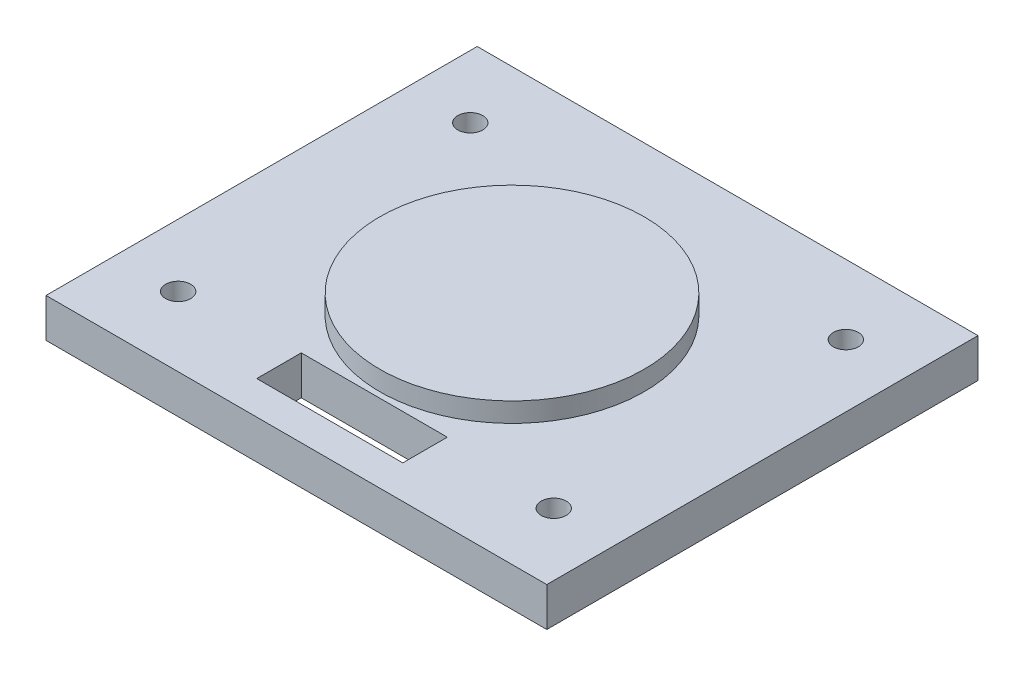
from build123d import *

# Parameters (mm, degrees)
F_01_BASE_PROFILE_W           = 360
F_01_BASE_PROFILE_H           = 310
F_01_BASE_PROFILE_R           = 62.5
F_01_BASE_PROFILE_R_2         = 9
F_01_BASE_PROFILE_W_2         = 105
F_01_BASE_PROFILE_H_2         = 32
F_01_BASE_EXTRUDE_DEPTH       = 28
F_02_BOSS_PROFILE_R           = 95
F_02_REINFORCEMENT_BOSS_DEPTH = 42


with BuildPart() as part:
    # 01_Base_Profile → 01_Base_Extrude (new body)
    with BuildSketch(Plane(origin=(0, 0, 0), x_dir=(1, 0, 0), z_dir=(0, 1, 0))):
        Rectangle(F_01_BASE_PROFILE_W, F_01_BASE_PROFILE_H)
        Circle(F_01_BASE_PROFILE_R, mode=Mode.SUBTRACT)
        with Locations((-135, -105)):
            Circle(F_01_BASE_PROFILE_R_2, mode=Mode.SUBTRACT)
        with Locations((135, -105)):
            Circle(F_01_BASE_PROFILE_R_2, mode=Mode.SUBTRACT)
        with Locations((-135, 105)):
            Circle(F_01_BASE_PROFILE_R_2, mode=Mode.SUBTRACT)
        with Locations((135, 105)):
            Circle(F_01_BASE_PROFILE_R_2, mode=Mode.SUBTRACT)
        with Locations((0, -115)):
            Rectangle(F_01_BASE_PROFILE_W_2, F_01_BASE_PROFILE_H_2, mode=Mode.SUBTRACT)
    extrude(amount=F_01_BASE_EXTRUDE_DEPTH)

    # 02_Boss_Profile → 02_Reinforcement_Boss (add)
    with BuildSketch(Plane(origin=(0, 0, 0), x_dir=(1, 0, 0), z_dir=(0, 1, 0))):
        Circle(F_02_BOSS_PROFILE_R)
    extrude(amount=F_02_REINFORCEMENT_BOSS_DEPTH)


solid = part.part
